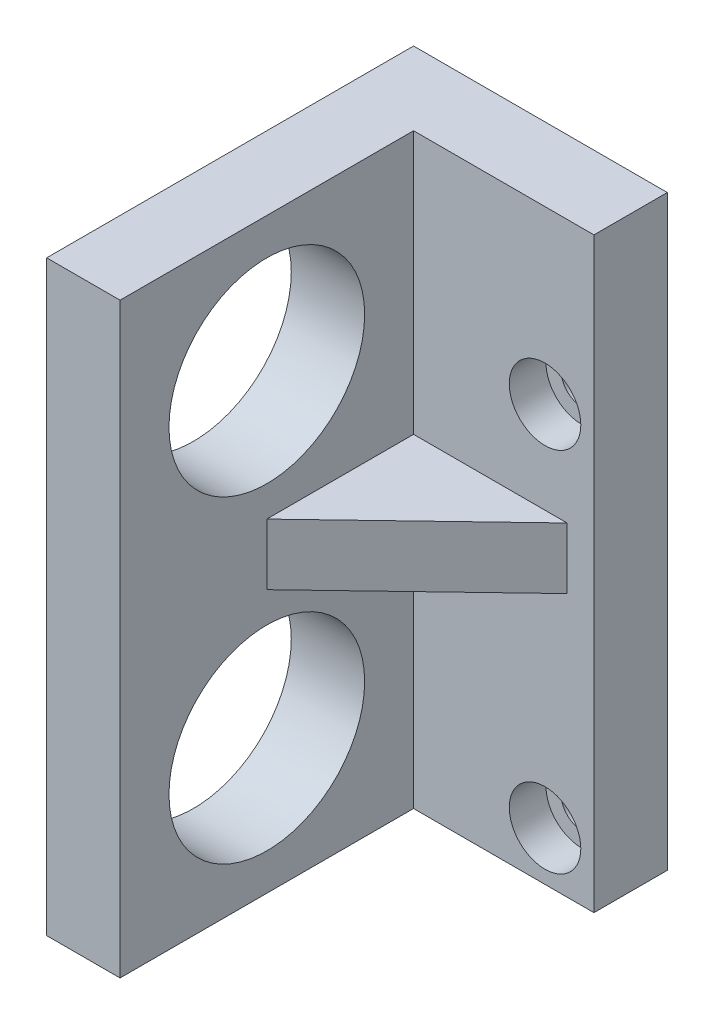
from build123d import *

# Parameters (mm, degrees)
SKETCH1_W           = 20.75
SKETCH1_H           = 48
SKETCH1_R           = 1.675
BOSS_EXTRUDE1_DEPTH = 6
SKETCH2_W           = 30
SKETCH2_H           = 48
BOSS_EXTRUDE2_DEPTH = 6
SKETCH3_R           = 8
CUT_EXTRUDE1_DEPTH  = 6
BOSS_EXTRUDE3_START = -26.5
BOSS_EXTRUDE3_DEPTH = 5
SKETCH5_R           = 2.925
CUT_EXTRUDE2_DEPTH  = 3


with BuildPart() as part:
    # Sketch1 → Boss-Extrude1 (new body)
    with BuildSketch(Plane.XY):
        with Locations((10.375, 24)):
            Rectangle(SKETCH1_W, SKETCH1_H)
        with Locations((16.75, 34)):
            Circle(SKETCH1_R, mode=Mode.SUBTRACT)
        with Locations((16.75, 4)):
            Circle(SKETCH1_R, mode=Mode.SUBTRACT)
    extrude(amount=BOSS_EXTRUDE1_DEPTH)

    # Sketch2 → Boss-Extrude2 (add)
    with BuildSketch(Plane.ZY):
        with Locations((15, 24)):
            Rectangle(SKETCH2_W, SKETCH2_H)
    extrude(amount=-BOSS_EXTRUDE2_DEPTH)

    # Sketch3 → Cut-Extrude1 (cut)
    with BuildSketch(Plane.ZY):
        with Locations((18, 37)):
            Circle(SKETCH3_R)
        with Locations((18, 11)):
            Circle(SKETCH3_R)
    extrude(amount=-CUT_EXTRUDE1_DEPTH, mode=Mode.SUBTRACT)

    # Sketch4 → Boss-Extrude3 (add)
    with BuildSketch(Plane(origin=(0, 48, 0), x_dir=(1, 0, 0), z_dir=(0, 1, 0)).offset(BOSS_EXTRUDE3_START)):
        Polygon((6, -18), (6, -6), (18.555883802, -6), align=None)
    extrude(amount=BOSS_EXTRUDE3_DEPTH)

    # Sketch5 → Cut-Extrude2 (cut)
    with BuildSketch(Plane.XY.offset(6)):
        with Locations((16.75, 34)):
            Circle(SKETCH5_R)
        with Locations((16.75, 4)):
            Circle(SKETCH5_R)
    extrude(amount=-CUT_EXTRUDE2_DEPTH, mode=Mode.SUBTRACT)


solid = part.part
